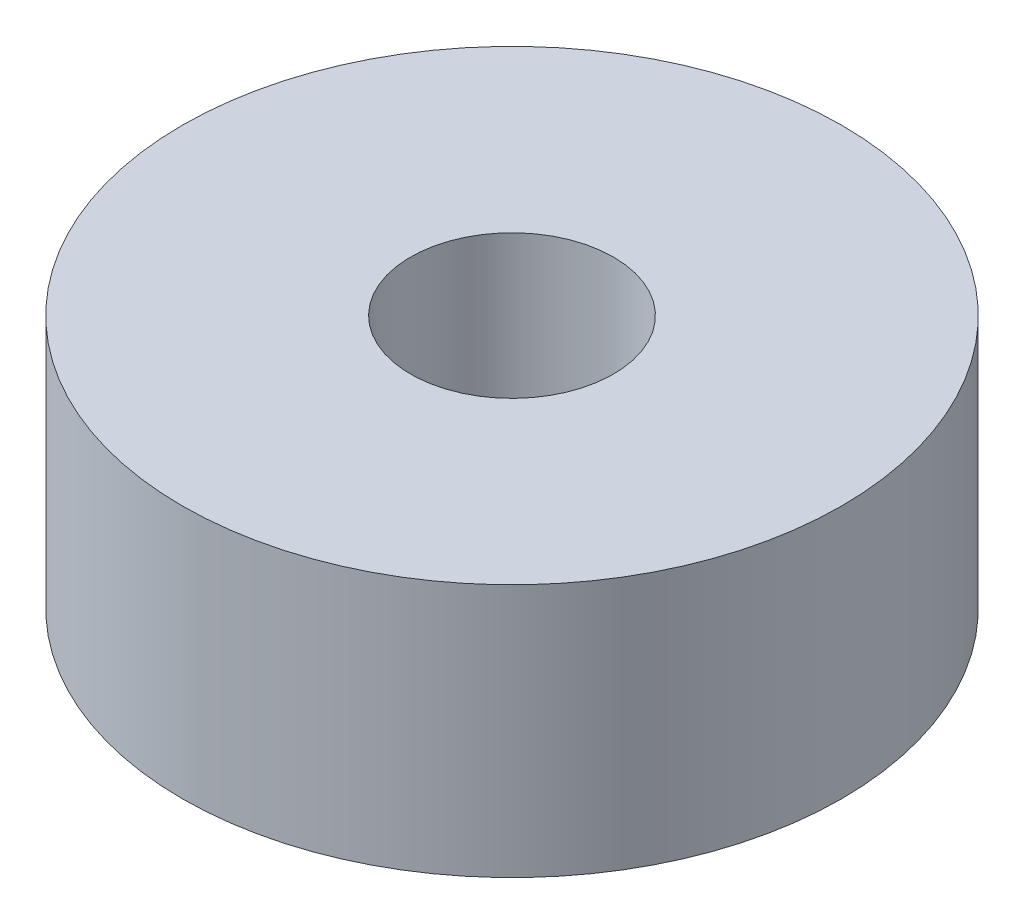
from build123d import *

# Parameters (mm, degrees)
ESQUISSE1_W = 4.5
ESQUISSE1_H = 5


with BuildPart() as part:
    # Esquisse1 → Révolution1 (revolve)
    with BuildSketch(Plane.XY):
        with Locations((4.25, 0)):
            Rectangle(ESQUISSE1_W, ESQUISSE1_H)
    revolve(axis=Axis((0, -2.39881159, 0), (0, 1, 0)))


solid = part.part
